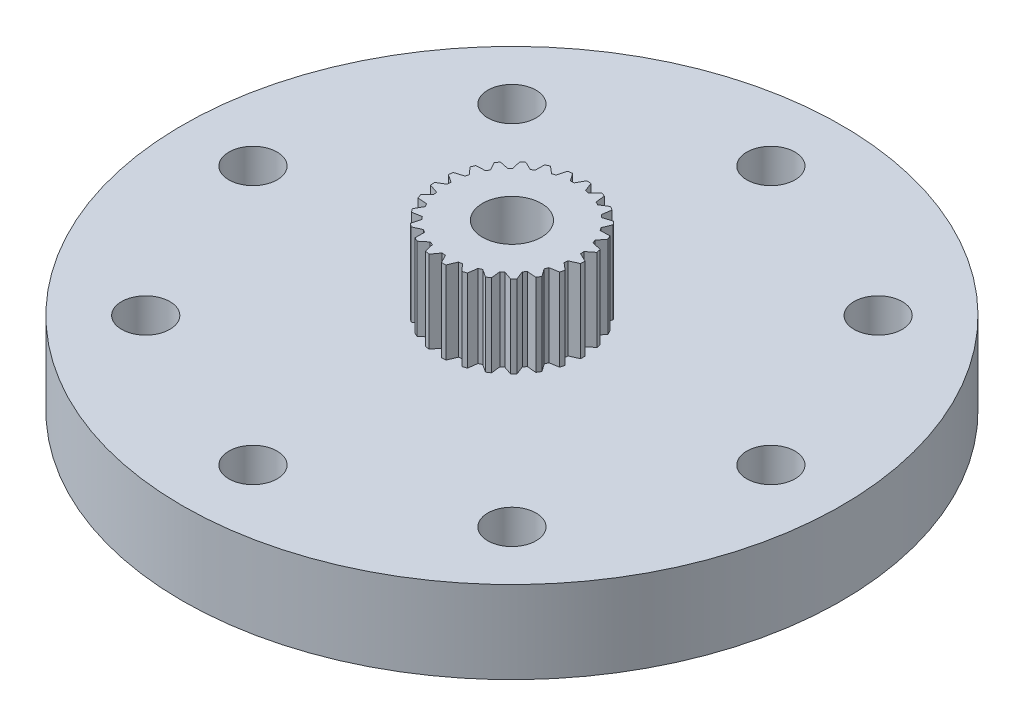
from build123d import *

# Parameters (mm, degrees)
SKETCH1_R                          = 14
BOSS_EXTRUDE1_DEPTH                = 1.75
TAP_DRILL_FOR_M2_5X0_45_TAP1_D     = 2.05
TAP_DRILL_FOR_M2_5X0_45_TAP1_DEPTH = 6
TAP_DRILL_FOR_M2_5X0_45_TAP1_TIP   = 0.615882135
SKETCH7_R                          = 5
CUT_EXTRUDE1_DEPTH                 = 2.3
BOSS_EXTRUDE3_DEPTH                = 3.5
TAP_DRILL_FOR_M3X0_5_TAP1_D        = 2.5
TAP_DRILL_FOR_M3X0_5_TAP1_DEPTH    = 6
TAP_DRILL_FOR_M3X0_5_TAP1_TIP      = 0.751075774


with BuildPart() as part:
    # Sketch1 → Boss-Extrude1 (new, symmetric)
    with BuildSketch(Plane(origin=(0, 0, 0), x_dir=(1, 0, 0), z_dir=(0, 1, 0))):
        Circle(SKETCH1_R)
    extrude(amount=BOSS_EXTRUDE1_DEPTH, both=True)

    # Tap Drill for M2.5x0.45 Tap1
    with Locations(Plane(origin=(0, 1.75, 0), x_dir=(1, 0, 0), z_dir=(0, 1, 0))):
        with Locations((-11, 0), (-7.778174593, 7.778174593), (0, 11), (7.778174593, 7.778174593), (11, 0), (7.778174593, -7.778174593), (0, -11), (-7.778174593, -7.778174593)):
            Hole(TAP_DRILL_FOR_M2_5X0_45_TAP1_D / 2, depth=TAP_DRILL_FOR_M2_5X0_45_TAP1_DEPTH)
            with Locations((0, 0, -(TAP_DRILL_FOR_M2_5X0_45_TAP1_DEPTH + TAP_DRILL_FOR_M2_5X0_45_TAP1_TIP / 2))):  # 118° drill point
                Cone(0, TAP_DRILL_FOR_M2_5X0_45_TAP1_D / 2, TAP_DRILL_FOR_M2_5X0_45_TAP1_TIP, mode=Mode.SUBTRACT)

    # Sketch7 → Cut-Extrude1 (cut)
    with BuildSketch(Plane.XZ.offset(1.75)):
        Circle(SKETCH7_R)
    extrude(amount=-CUT_EXTRUDE1_DEPTH, mode=Mode.SUBTRACT)

    # Sketch8 → Boss-Extrude3 (add)
    with BuildSketch(Plane(origin=(0, 1.75, 0), x_dir=(1, 0, 0), z_dir=(0, 1, 0))):
        with BuildLine():
            Line((-0.128852443, -2.696923627), (0.057352661, -3.049460718))
            ThreePointArc((0.057352661, -3.049460718), (0.151245078, -3.04624768), (0.244993995, -3.040144395))
            Line((0.244993995, -3.040144395), (0.395362741, -2.670896535))
            ThreePointArc((0.395362741, -2.670896535), (0.470816738, -2.658633408), (0.545893326, -2.644239111))
            Line((0.545893326, -2.644239111), (0.813920864, -2.939393275))
            ThreePointArc((0.813920864, -2.939393275), (0.904064427, -2.912931086), (0.993350224, -2.883705139))
            Line((0.993350224, -2.883705139), (1.047166652, -2.488662694))
            ThreePointArc((1.047166652, -2.488662694), (1.117200406, -2.458020189), (1.18633861, -2.425407327))
            Line((1.18633861, -2.425407327), (1.519347425, -2.644632943))
            ThreePointArc((1.519347425, -2.644632943), (1.600078084, -2.596584319), (1.679290606, -2.546072084))
            Line((1.679290606, -2.546072084), (1.63317323, -2.150057022))
            ThreePointArc((1.63317323, -2.150057022), (1.693386265, -2.102960522), (1.752241875, -2.054178281))
            Line((1.752241875, -2.054178281), (2.1293078, -2.183700596))
            ThreePointArc((2.1293078, -2.183700596), (2.19555295, -2.11708461), (2.259714983, -2.048459957))
            Line((2.259714983, -2.048459957), (2.116561528, -1.676355361))
            ThreePointArc((2.116561528, -1.676355361), (2.163170436, -1.615764111), (2.208045339, -1.553877659))
            Line((2.208045339, -1.553877659), (2.605475935, -1.58555831))
            ThreePointArc((2.605475935, -1.58555831), (2.653073149, -1.504560688), (2.698153157, -1.422135556))
            Line((2.698153157, -1.422135556), (2.466958481, -1.097322127))
            ThreePointArc((2.466958481, -1.097322127), (2.497034654, -1.027043299), (2.525109194, -0.955941189))
            Line((2.525109194, -0.955941189), (2.917932434, -0.887789563))
            ThreePointArc((2.917932434, -0.887789563), (2.943891005, -0.797499685), (2.967056445, -0.706453148))
            Line((2.967056445, -0.706453148), (2.66234736, -0.449340108))
            ThreePointArc((2.66234736, -0.449340108), (2.674001, -0.373789578), (2.683511152, -0.297939418))
            Line((2.683511152, -0.297939418), (3.047044507, -0.134237734))
            ThreePointArc((3.047044507, -0.134237734), (3.049733363, -0.040328844), (3.049528665, 0.053618309))
            Line((3.049528665, 0.053618309), (2.690451163, 0.226875602))
            ThreePointArc((2.690451163, 0.226875602), (2.68295003, 0.302950716), (2.673298235, 0.378782983))
            Line((2.673298235, 0.378782983), (2.984699568, 0.627748746))
            ThreePointArc((2.984699568, 0.627748746), (2.963949757, 0.719376006), (2.940387783, 0.810320731))
            Line((2.940387783, 0.810320731), (2.549504025, 0.888835884))
            ThreePointArc((2.549504025, 0.888835884), (2.523319442, 0.960655502), (2.495112158, 1.031705055))
            Line((2.495112158, 1.031705055), (2.734814978, 1.350291464))
            ThreePointArc((2.734814978, 1.350291464), (2.691930287, 1.433879817), (2.646491522, 1.516107721))
            Line((2.646491522, 1.516107721), (2.248362172, 1.494947338))
            ThreePointArc((2.248362172, 1.494947338), (2.205139413, 1.55799877), (2.160149007, 1.619801305))
            Line((2.160149007, 1.619801305), (2.313091905, 1.987990402))
            ThreePointArc((2.313091905, 1.987990402), (2.250766937, 2.058287685), (2.186306467, 2.126632087))
            Line((2.186306467, 2.126632087), (1.805947455, 2.007125753))
            ThreePointArc((1.805947455, 2.007125753), (1.748402365, 2.057447246), (1.68945575, 2.106119481))
            Line((1.68945575, 2.106119481), (1.74602876, 2.500776593))
            ThreePointArc((1.74602876, 2.500776593), (1.668179623, 2.553365768), (1.588747735, 2.603532338))
            Line((1.588747735, 2.603532338), (1.250058417, 2.393189076))
            ThreePointArc((1.250058417, 2.393189076), (1.181806766, 2.427618744), (1.112607775, 2.460102424))
            Line((1.112607775, 2.460102424), (1.069256207, 2.856429793))
            ThreePointArc((1.069256207, 2.856429793), (0.980774447, 2.888006489), (0.89136214, 2.916843077))
            Line((0.89136214, 2.916843077), (0.615623612, 2.628879527))
            ThreePointArc((0.615623612, 2.628879527), (0.540953902, 2.645254028), (0.465850562, 2.659508085))
            Line((0.465850562, 2.659508085), (0.325298354, 3.032603004))
            ThreePointArc((0.325298354, 3.032603004), (0.231743607, 3.041183141), (0.137968984, 3.046877838))
            Line((0.137968984, 3.046877838), (-0.057493089, 2.699387809))
            ThreePointArc((-0.057493089, 2.699387809), (-0.133889085, 2.696678274), (-0.210177756, 2.691807071))
            Line((-0.210177756, 2.691807071), (-0.439099191, 3.018226615))
            ThreePointArc((-0.439099191, 3.018226615), (-0.531848537, 3.003271072), (-0.624093271, 2.985466059))
            Line((-0.624093271, 2.985466059), (-0.726997287, 2.600283627))
            ThreePointArc((-0.726997287, 2.600283627), (-0.800319329, 2.578660305), (-0.872999832, 2.55496992))
            Line((-0.872999832, 2.55496992), (-1.175906519, 2.814203948))
            ThreePointArc((-1.175906519, 2.814203948), (-1.262022681, 2.776652436), (-1.346941451, 2.736466467))
            Line((-1.346941451, 2.736466467), (-1.350821572, 2.337794062))
            ThreePointArc((-1.350821572, 2.337794062), (-1.416462566, 2.298615626), (-1.480968118, 2.257594612))
            Line((-1.480968118, 2.257594612), (-1.838827315, 2.433354496))
            ThreePointArc((-1.838827315, 2.433354496), (-1.912899299, 2.375566516), (-1.985156345, 2.315524624))
            Line((-1.985156345, 2.315524624), (-1.88976877, 1.928412299))
            ThreePointArc((-1.88976877, 1.928412299), (-1.943604251, 1.874140474), (-1.995881731, 1.818366332))
            Line((-1.995881731, 1.818366332), (-2.386207829, 1.899608433))
            ThreePointArc((-2.386207829, 1.899608433), (-2.443581419, 1.825215014), (-2.498636566, 1.749089852))
            Line((-2.498636566, 1.749089852), (-2.309974846, 1.397861298))
            ThreePointArc((-2.309974846, 1.397861298), (-2.348622132, 1.331906183), (-2.385386754, 1.264883407))
            Line((-2.385386754, 1.264883407), (-2.783654129, 1.246502985))
            ThreePointArc((-2.783654129, 1.246502985), (-2.820724331, 1.160178541), (-2.855118261, 1.072753333))
            Line((-2.855118261, 1.072753333), (-2.585036707, 0.779477531))
            ThreePointArc((-2.585036707, 0.779477531), (-2.606067447, 0.705983328), (-2.625009154, 0.631923206))
            Line((-2.625009154, 0.631923206), (-3.006193202, 0.51507517))
            ThreePointArc((-3.006193202, 0.51507517), (-3.02063076, 0.422243783), (-3.032202376, 0.329011776))
            Line((-3.032202376, 0.329011776), (-2.697671205, 0.112116324))
            ThreePointArc((-2.697671205, 0.112116324), (-2.69976396, 0.035700944), (-2.699692576, -0.040743054))
            Line((-2.699692576, -0.040743054), (-3.0398421, -0.248716711))
            ThreePointArc((-3.0398421, -0.248716711), (-3.030739849, -0.342222105), (-3.018762064, -0.435402801))
            Line((-3.018762064, -0.435402801), (-2.640801099, -0.562289564))
            ThreePointArc((-2.640801099, -0.562289564), (-2.623824375, -0.636824661), (-2.604744383, -0.710849278))
            Line((-2.604744383, -0.710849278), (-2.88248654, -0.996880808))
            ThreePointArc((-2.88248654, -0.996880808), (-2.850416406, -1.085184919), (-2.815641829, -1.172459418))
            Line((-2.815641829, -1.172459418), (-2.417999748, -1.201364731))
            ThreePointArc((-2.417999748, -1.201364731), (-2.383020254, -1.269336231), (-2.346130522, -1.336290227))
            Line((-2.346130522, -1.336290227), (-2.544013749, -1.682407216))
            ThreePointArc((-2.544013749, -1.682407216), (-2.490990819, -1.759961574), (-2.435604463, -1.835846099))
            Line((-2.435604463, -1.835846099), (-2.04326658, -1.764953733))
            ThreePointArc((-2.04326658, -1.764953733), (-1.992482207, -1.822090738), (-1.940100652, -1.877767147))
            Line((-1.940100652, -1.877767147), (-2.045691219, -2.262221792))
            ThreePointArc((-2.045691219, -2.262221792), (-1.975047116, -2.32415337), (-1.902529111, -2.383879817))
            Line((-1.902529111, -2.383879817), (-1.540147459, -2.217644202))
            ThreePointArc((-1.540147459, -2.217644202), (-1.476749174, -2.260356582), (-1.412167122, -2.301257052))
            Line((-1.412167122, -2.301257052), (-1.418830385, -2.699892653))
            ThreePointArc((-1.418830385, -2.699892653), (-1.33500394, -2.742310063), (-1.249910858, -2.782125599))
            Line((-1.249910858, -2.782125599), (-0.940255208, -2.530991929))
            ThreePointArc((-0.940255208, -2.530991929), (-0.86822656, -2.556595909), (-0.795501939, -2.580150512))
            Line((-0.795501939, -2.580150512), (-0.70281922, -2.967919329))
            ThreePointArc((-0.70281922, -2.967919329), (-0.611077556, -2.988157329), (-0.518756109, -3.005560197))
            Line((-0.518756109, -3.005560197), (-0.281283264, -2.685308125))
            ThreePointArc((-0.281283264, -2.685308125), (-0.205150078, -2.692194912), (-0.128852443, -2.696923627))
        make_face()
    extrude(amount=BOSS_EXTRUDE3_DEPTH)

    # Tap Drill for M3x0.5 Tap1
    with Locations(Plane(origin=(0, 5.25, 0), x_dir=(1, 0, 0), z_dir=(0, 1, 0))):
        with Locations((0, 0)):
            Hole(TAP_DRILL_FOR_M3X0_5_TAP1_D / 2, depth=TAP_DRILL_FOR_M3X0_5_TAP1_DEPTH)
            with Locations((0, 0, -(TAP_DRILL_FOR_M3X0_5_TAP1_DEPTH + TAP_DRILL_FOR_M3X0_5_TAP1_TIP / 2))):  # 118° drill point
                Cone(0, TAP_DRILL_FOR_M3X0_5_TAP1_D / 2, TAP_DRILL_FOR_M3X0_5_TAP1_TIP, mode=Mode.SUBTRACT)


solid = part.part
